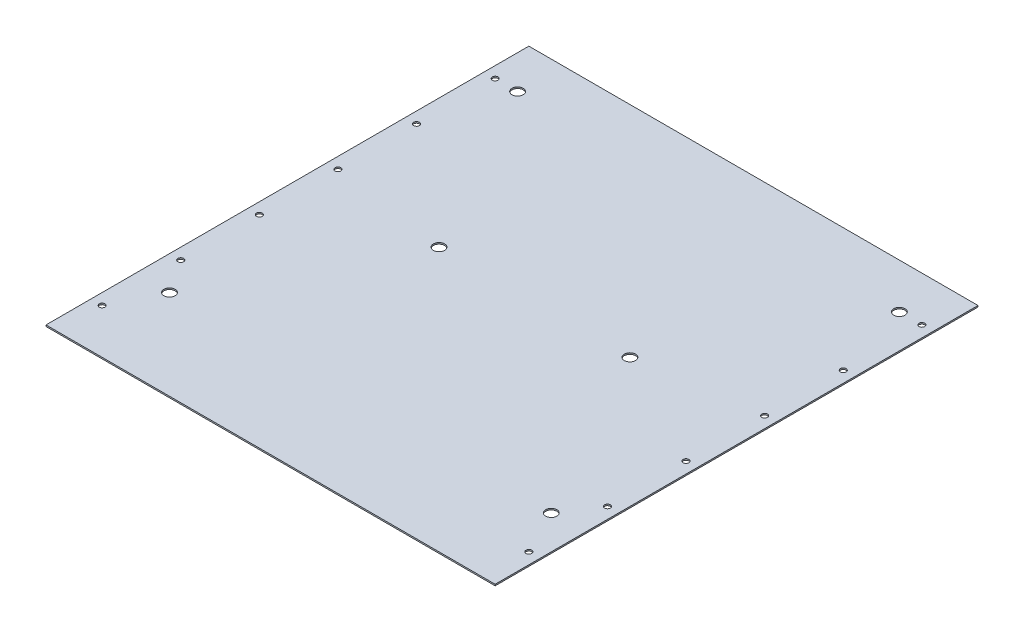
from build123d import *

# Parameters (mm, degrees)
SKETCH1_W           = 508
SKETCH1_H           = 546.1
BOSS_EXTRUDE1_DEPTH = 1.6002
SKETCH2_R           = 6.35
CUT_EXTRUDE1_DEPTH  = 2.54
SKETCH3_R           = 3.2639
CUT_EXTRUDE3_DEPTH  = 373.927423422
SKETCH4_R           = 6.35
CUT_EXTRUDE4_DEPTH  = 2.54


with BuildPart() as part:
    # Sketch1 → Boss-Extrude1 (new body)
    with BuildSketch(Plane(origin=(0, 0, 0), x_dir=(1, 0, 0), z_dir=(0, 1, 0))):
        Rectangle(SKETCH1_W, SKETCH1_H)
    extrude(amount=BOSS_EXTRUDE1_DEPTH)

    # Sketch2 → Cut-Extrude1 (cut)
    with BuildSketch(Plane(origin=(0, 1.6002, 0), x_dir=(1, 0, 0), z_dir=(0, 1, 0))):
        with Locations(Location((215.9, 222.25, 0), (0, 0, 270))):
            Circle(SKETCH2_R)
        with Locations(Location((215.9, -171.45, 0), (0, 0, 270))):
            Circle(SKETCH2_R)
        with Locations(Location((-215.9, 222.25, 0), (0, 0, 270))):
            Circle(SKETCH2_R)
        with Locations(Location((-215.9, -171.45, 0), (0, 0, 270))):
            Circle(SKETCH2_R)
    extrude(amount=-CUT_EXTRUDE1_DEPTH, mode=Mode.SUBTRACT)

    # Sketch3 → Cut-Extrude3 (cut, through all)
    with BuildSketch(Plane(origin=(0, 1.6002, 0), x_dir=(1, 0, 0), z_dir=(0, 1, 0))):
        with Locations(Location((-241.3, 222.25, 0), (0, 0, 270))):
            Circle(SKETCH3_R)
        with Locations(Location((-241.3, 133.35, 0), (0, 0, 270))):
            Circle(SKETCH3_R)
        with Locations(Location((-241.3, 44.45, 0), (0, 0, 270))):
            Circle(SKETCH3_R)
        with Locations(Location((-241.3, -44.45, 0), (0, 0, 270))):
            Circle(SKETCH3_R)
        with Locations(Location((-241.3, -133.35, 0), (0, 0, 270))):
            Circle(SKETCH3_R)
        with Locations(Location((-241.3, -222.25, 0), (0, 0, 270))):
            Circle(SKETCH3_R)
        with Locations(Location((241.3, 222.25, 0), (0, 0, 90))):
            Circle(SKETCH3_R)
        with Locations(Location((241.3, 133.35, 0), (0, 0, 90))):
            Circle(SKETCH3_R)
        with Locations(Location((241.3, 44.45, 0), (0, 0, 90))):
            Circle(SKETCH3_R)
        with Locations(Location((241.3, -44.45, 0), (0, 0, 90))):
            Circle(SKETCH3_R)
        with Locations(Location((241.3, -133.35, 0), (0, 0, 90))):
            Circle(SKETCH3_R)
        with Locations(Location((241.3, -222.25, 0), (0, 0, 90))):
            Circle(SKETCH3_R)
    extrude(amount=-CUT_EXTRUDE3_DEPTH, mode=Mode.SUBTRACT)

    # Sketch4 → Cut-Extrude4 (cut)
    with BuildSketch(Plane(origin=(0, 1.6002, 0), x_dir=(1, 0, 0), z_dir=(0, 1, 0))):
        with Locations(Location((107.95, 25.4, 0), (0, 0, 270))):
            Circle(SKETCH4_R)
        with Locations(Location((-107.95, 25.4, 0), (0, 0, 270))):
            Circle(SKETCH4_R)
    extrude(amount=-CUT_EXTRUDE4_DEPTH, mode=Mode.SUBTRACT)


solid = part.part
